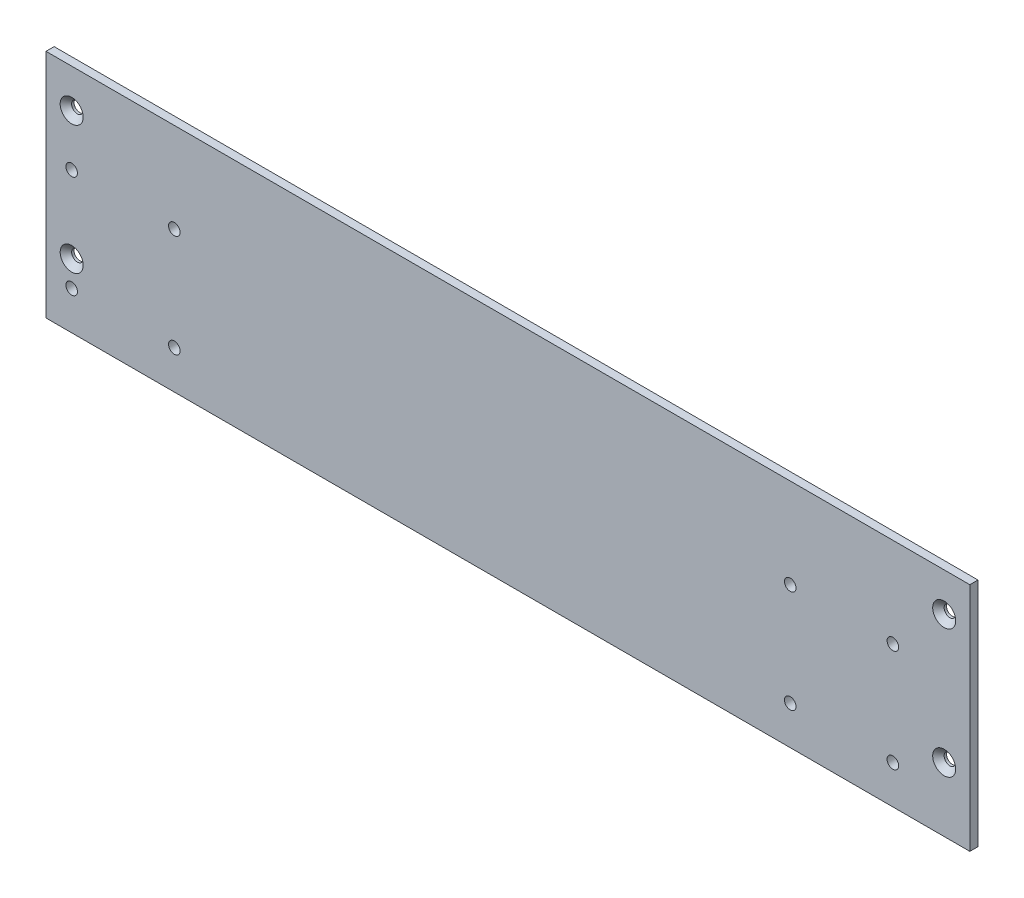
from build123d import *

# Parameters (mm, degrees)
SKETCH1_W                     = 360
SKETCH1_H                     = 90
BOSS_EXTRUDE1_DEPTH           = 3.175
M4_CLEARANCE_HOLE1_D          = 4.5
CSK_FOR_M4_SFHCS1_D           = 4.5
CSK_FOR_M4_SFHCS1_DEPTH       = 10.1
CSK_FOR_M4_SFHCS1_CSINK_D     = 8.96
CSK_FOR_M4_SFHCS1_CSINK_ANGLE = 90
CSK_FOR_M4_SFHCS1_TIP         = 1.351936393


with BuildPart() as part:
    # Sketch1 → Boss-Extrude1 (new body)
    with BuildSketch(Plane.XY):
        Rectangle(SKETCH1_W, SKETCH1_H)
    extrude(amount=BOSS_EXTRUDE1_DEPTH)

    # M4 Clearance Hole1 (through all)
    with Locations(Plane.XY.offset(3.175)):
        with Locations((-130, 10), (-170, -30), (-170, 10), (-130, -30), (110, 10), (150, 10), (150, -30), (110, -30)):
            Hole(M4_CLEARANCE_HOLE1_D / 2)

    # CSK for M4 SFHCS1
    with Locations(Plane.XY.offset(3.175)):
        with Locations((170, 30), (-170, -20), (-170, 30), (170, -20)):
            CounterSinkHole(CSK_FOR_M4_SFHCS1_D / 2, CSK_FOR_M4_SFHCS1_CSINK_D / 2, depth=CSK_FOR_M4_SFHCS1_DEPTH, counter_sink_angle=CSK_FOR_M4_SFHCS1_CSINK_ANGLE)
            with Locations((0, 0, -(CSK_FOR_M4_SFHCS1_DEPTH + CSK_FOR_M4_SFHCS1_TIP / 2))):  # 118° drill point
                Cone(0, CSK_FOR_M4_SFHCS1_D / 2, CSK_FOR_M4_SFHCS1_TIP, mode=Mode.SUBTRACT)


solid = part.part
